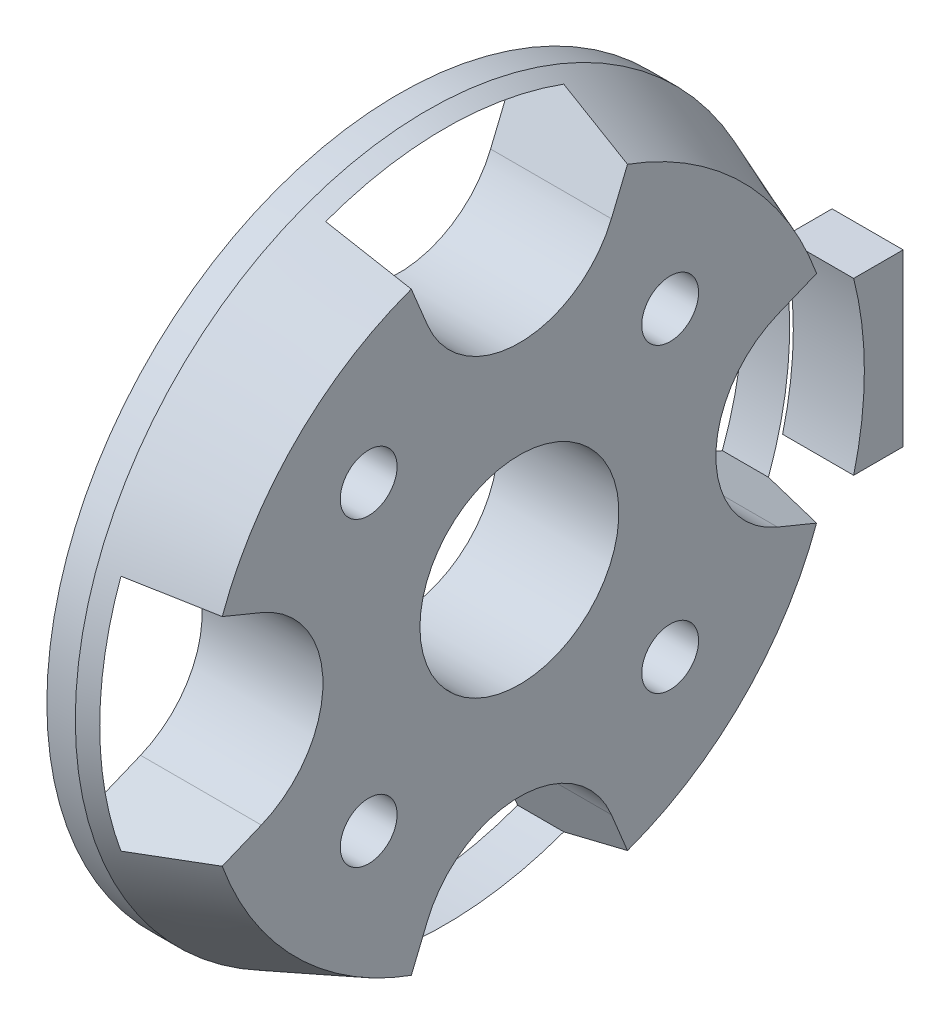
from build123d import *

# Parameters (mm, degrees)
SKETCH3_R           = 2
CUT_EXTRUDE1_DEPTH  = 5
SKETCH4_W           = 12
SKETCH4_H           = 12
BOSS_EXTRUDE1_DEPTH = 5
CUT_EXTRUDE2_DEPTH  = 38.600698132
CIRPATTERN1_COUNT   = 4


with BuildPart() as part:
    # Sketch2 → Revolve1 (revolve)
    with BuildSketch(Plane.XY):
        Polygon((0, 24.75), (2, 24.75), (8.5, 22.25), (8.5, 7), (0, 7), align=None)
    revolve(axis=Axis((0, 0, 0), (1, 0, 0)))

    # Sketch3 → Cut-Extrude1 (cut)
    with BuildSketch(Plane(origin=(8.5, 0, 0), x_dir=(0, 0, -1), z_dir=(1, 0, 0))):
        with Locations((10.606601718, 10.606601718)):
            Circle(SKETCH3_R)
        with Locations((10.606601718, -10.606601718)):
            Circle(SKETCH3_R)
        with Locations((-10.606601718, -10.606601718)):
            Circle(SKETCH3_R)
        with Locations((-10.606601718, 10.606601718)):
            Circle(SKETCH3_R)
    extrude(amount=-CUT_EXTRUDE1_DEPTH, mode=Mode.SUBTRACT)

    # Sketch4 → Boss-Extrude1 (add)
    with BuildSketch(Plane(origin=(8.5, 0, 0), x_dir=(0, 0, -1), z_dir=(1, 0, 0))):
        with Locations((21, 0)):
            Rectangle(SKETCH4_W, SKETCH4_H)
    extrude(amount=-BOSS_EXTRUDE1_DEPTH)

    # Sketch6 → Cut-Extrude2 (cut, through all)
    with BuildSketch(Plane(origin=(8.5, 0, 0), x_dir=(0, 0, -1), z_dir=(1, 0, 0))):
        with BuildLine():
            Line((-6.472300805, 18.157581623), (-7.606019278, 20.909590401))
            Line((-7.606019278, 20.909590401), (-8.376823121, 22.780653627))
            ThreePointArc((-8.376823121, 22.780653627), (0, 24.271986842), (8.376823121, 22.780653627))
            Line((8.376823121, 22.780653627), (7.606019278, 20.909590401))
            Line((7.606019278, 20.909590401), (6.472300805, 18.157581623))
            ThreePointArc((6.472300805, 18.157581623), (0, 13.823912866), (-6.472300805, 18.157581623))
        make_face()
    cut_extrude2 = extrude(amount=-CUT_EXTRUDE2_DEPTH, mode=Mode.SUBTRACT)

    # CirPattern1: Cut-Extrude2 ×4 about axis
    cirpattern1_axis = Axis((0, 0, 0), (-1, 0, 0))
    for i in range(1, CIRPATTERN1_COUNT):
        add(cut_extrude2.rotate(cirpattern1_axis, i * 360 / CIRPATTERN1_COUNT), mode=Mode.SUBTRACT)


solid = part.part
